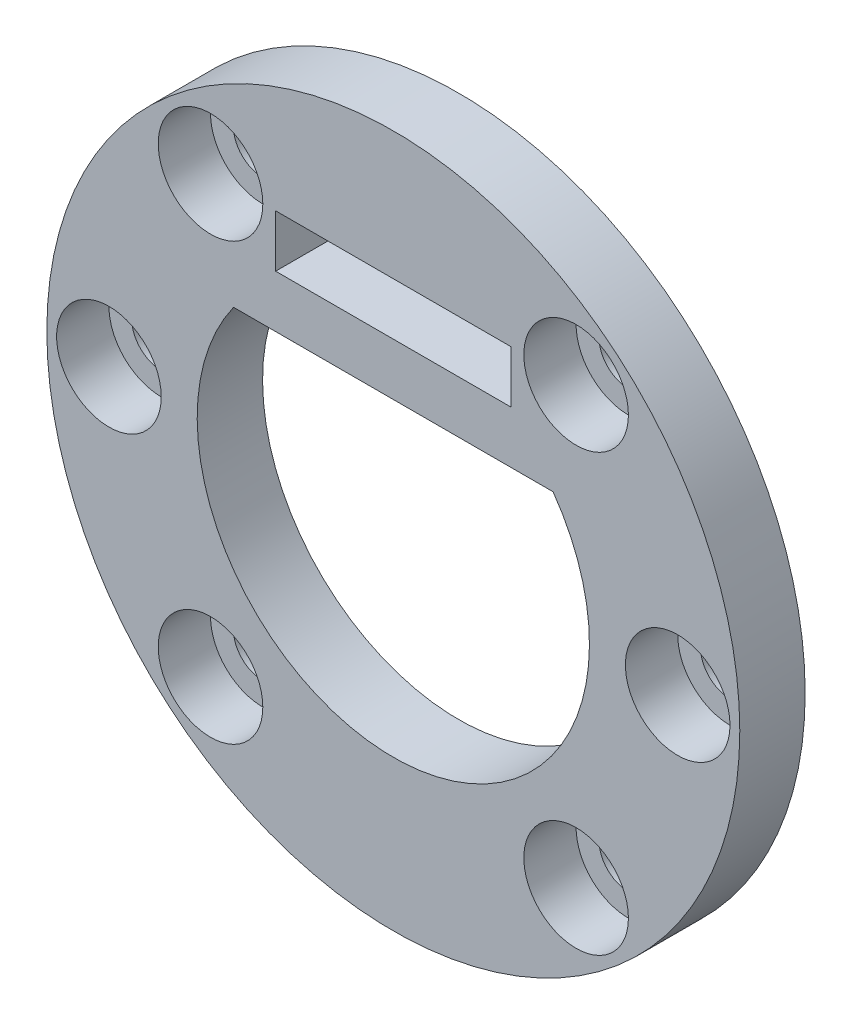
from build123d import *
from build123d.topology import SkipClean

# Parameters (mm, degrees)
SKETCH_1_R                   = 26.5
EXTRUDE_1_DEPTH              = 5
HOLE_WIZARD_M4_1_AT_2_COUNT  = 2
HOLE_WIZARD_M4_1_AT_2_PITCH  = 39.424388736
HOLE_WIZARD_M4_1_AT_3_COUNT  = 2
HOLE_WIZARD_M4_1_AT_3_PITCH  = 39.424388736
HOLE_WIZARD_M4_1_AT_4_COUNT  = 2
HOLE_WIZARD_M4_1_AT_4_PITCH  = 18.383894388
HOLE_WIZARD_M4_1_AT_5_COUNT  = 2
HOLE_WIZARD_M4_1_AT_5_PITCH  = 43.5
HOLE_WIZARD_M4_1_AT_6_COUNT  = 2
HOLE_WIZARD_M4_1_AT_6_PITCH  = 39.424388736
HOLE_WIZARD_M4_1_AT_7_COUNT  = 2
HOLE_WIZARD_M4_1_AT_7_PITCH  = 18.383894388
EXTRUDE_1551_DEPTH           = 8
CUT_EXTRUDE_START            = 22
SKETCH_6_R                   = 4
CUT_EXTRUDE_1661_DEPTH       = 22
SKETCH_8_R                   = 34.5
CUT_EXTRUDE_1747_DEPTH       = 119.962346984
HOLE_WIZARD_M3_1_D           = 3.4
HOLE_WIZARD_M3_1_CBORE_D     = 6.5
HOLE_WIZARD_M3_1_CBORE_DEPTH = 3
CUT_EXTRUDE_1_DEPTH          = 15
CUT_EXTRUDE_2_DEPTH          = 5
CUT_EXTRUDE_3_DEPTH          = 10
SKETCH_15_W                  = 96
SKETCH_15_H                  = 8
CUT_EXTRUDE_4_DEPTH          = 113.29536945
CUT_EXTRUDE_5_DEPTH          = 10


with BuildPart() as part:
    # 草图1 → 凸台-拉伸1 (new body)
    with BuildSketch(Plane.XY):
        Circle(SKETCH_1_R)
    extrude(amount=EXTRUDE_1_DEPTH)

    # 草图3 → M4 六角凹头盖的柱孔1 (revolve, cut)
    with BuildSketch(Plane(origin=(21.75, 0, 5), x_dir=(0, -1, 0), z_dir=(1, 0, 0))):
        Polygon((0, 0), (0, 5), (2.25, 5), (2.25, 4), (4, 4), (4, 0), align=None)
    hole_wizard_m4_1 = revolve(axis=Axis((21.75, 0, 11.35), (0, 0, -1)), mode=Mode.SUBTRACT)

    # M4 六角凹头盖的柱孔1 at 2: M4 六角凹头盖的柱孔1 ×2
    with Locations(*[Vector(-0.9063077870366496, 0.4226182617407002, 0) * (i * HOLE_WIZARD_M4_1_AT_2_PITCH) for i in range(1, HOLE_WIZARD_M4_1_AT_2_COUNT)]):
        add(hole_wizard_m4_1, mode=Mode.SUBTRACT)

    # M4 六角凹头盖的柱孔1 at 3: M4 六角凹头盖的柱孔1 ×2
    with Locations(*[Vector(-0.9063077870125524, 0.42261826179237694, 0) * (i * HOLE_WIZARD_M4_1_AT_3_PITCH) for i in range(1, HOLE_WIZARD_M4_1_AT_3_COUNT)]):
        add(hole_wizard_m4_1, mode=Mode.SUBTRACT)

    # M4 六角凹头盖的柱孔1 at 4: M4 六角凹头盖的柱孔1 ×2
    with Locations(*[Vector(-0.42261826172613215, 0.9063077870434428, 0) * (i * HOLE_WIZARD_M4_1_AT_4_PITCH) for i in range(1, HOLE_WIZARD_M4_1_AT_4_COUNT)]):
        add(hole_wizard_m4_1, mode=Mode.SUBTRACT)

    # M4 六角凹头盖的柱孔1 at 5: M4 六角凹头盖的柱孔1 ×2
    with Locations(*[(-i * HOLE_WIZARD_M4_1_AT_5_PITCH, 0, 0) for i in range(1, HOLE_WIZARD_M4_1_AT_5_COUNT)]):
        add(hole_wizard_m4_1, mode=Mode.SUBTRACT)

    # M4 六角凹头盖的柱孔1 at 6: M4 六角凹头盖的柱孔1 ×2
    with Locations(*[Vector(-0.9063077870125524, -0.42261826179237694, 0) * (i * HOLE_WIZARD_M4_1_AT_6_PITCH) for i in range(1, HOLE_WIZARD_M4_1_AT_6_COUNT)]):
        add(hole_wizard_m4_1, mode=Mode.SUBTRACT)

    # M4 六角凹头盖的柱孔1 at 7: M4 六角凹头盖的柱孔1 ×2
    with Locations(*[Vector(-0.42261826172613215, -0.9063077870434428, 0) * (i * HOLE_WIZARD_M4_1_AT_7_PITCH) for i in range(1, HOLE_WIZARD_M4_1_AT_7_COUNT)]):
        add(hole_wizard_m4_1, mode=Mode.SUBTRACT)

    # 草图5 → Extrude 1551 (add)
    with BuildSketch(Plane.XZ.offset(-8.7)):
        with BuildLine():
            Line((-26.5, 5), (-26.5, 14.978130978))
            ThreePointArc((-26.5, 14.978130978), (0, 103), (26.5, 14.978130978))
            Line((26.5, 14.978130978), (26.5, 5))
            Line((26.5, 5), (-26.5, 5))
        make_face()
    extrude(amount=-EXTRUDE_1551_DEPTH)

    # 草图6 → Cut-Extrude 1661 (cut)
    with SkipClean():  # the faces are left unmerged after this step: merging them gives an invalid solid
        with BuildSketch(Plane.XY.offset(5).offset(CUT_EXTRUDE_START)):
            with Locations((-13.98063051, 16.66146664)):
                Circle(SKETCH_6_R)
            with Locations((13.98063051, 16.66146664)):
                Circle(SKETCH_6_R)
        extrude(amount=-CUT_EXTRUDE_1661_DEPTH, mode=Mode.SUBTRACT)
    add(part.part.scale(1), mode=Mode.REPLACE)  # the faces are merged on a copy

    # 草图8 → Cut-Extrude 1747 (cut, through all)
    with BuildSketch(Plane.XZ.offset(-8.7)):
        with Locations((0, 55)):
            Circle(SKETCH_8_R)
    extrude(amount=-CUT_EXTRUDE_1747_DEPTH, mode=Mode.SUBTRACT)

    # M3 六角凹头盖的柱孔1 (through all)
    with Locations(Plane(origin=(-9.576304669, 16.7, 19.260744427), x_dir=(0, 0, 1), z_dir=(0, 1, 0))):
        with Locations((0, 0), (0, 19.152609338), (9.576304669, 35.739255573), (26.162950904, 45.315560242), (45.315560242, 45.315560242), (62.358629164, 36.19567826), (71.478511143, 19.152609339), (71.478511146, 0), (61.902206477, -16.586646235), (9.576304669, -16.586646235), (26.162950904, -26.162950904), (45.315560242, -26.162950904)):
            CounterBoreHole(HOLE_WIZARD_M3_1_D / 2, HOLE_WIZARD_M3_1_CBORE_D / 2, HOLE_WIZARD_M3_1_CBORE_DEPTH)

    # 草图11 → 切除-拉伸1 (cut)
    with BuildSketch(Plane.XY):
        with BuildLine():
            Line((-25.031180555, 8.7), (-29.031180555, 8.7))
            Line((-29.031180555, 8.7), (-29.031180555, 16.7))
            Line((-29.031180555, 16.7), (-20.575713839, 16.7))
            ThreePointArc((-20.575713839, 16.7), (-23.151613423, 12.893905379), (-25.031180555, 8.7))
        make_face()
        with BuildLine():
            Line((29.031180555, 16.7), (20.575713839, 16.7))
            ThreePointArc((20.575713839, 16.7), (23.151613423, 12.893905379), (25.031180555, 8.7))
            Line((25.031180555, 8.7), (29.031180555, 8.7))
            Line((29.031180555, 8.7), (29.031180555, 16.7))
        make_face()
    extrude(amount=CUT_EXTRUDE_1_DEPTH, mode=Mode.SUBTRACT)

    # 草图12 → 切除-拉伸2 (cut)
    with BuildSketch(Plane.XZ.offset(-8.7)):
        with BuildLine():
            Line((30.640436297, 73.992699353), (39.299497484, 79.033088453))
            ThreePointArc((39.299497484, 79.033088453), (22.961941343, 94.93481054), (1, 101.054748323))
            Line((1, 101.054748323), (1, 90.986108088))
            ThreePointArc((1, 90.986108088), (3.29678588, 90.848726312), (5.580104544, 90.56490417))
            ThreePointArc((5.580104544, 90.56490417), (10.611585442, 94.602959438), (12.949935188, 88.59015553))
            ThreePointArc((12.949935188, 88.59015553), (18.110429302, 86.112886725), (22.813026139, 82.848971404))
            ThreePointArc((22.813026139, 82.848971404), (29.429042421, 84.466469087), (27.899229179, 77.829629354))
            ThreePointArc((27.899229179, 77.829629354), (29.332637394, 75.956033707), (30.640436297, 73.992699353))
        make_face()
        with BuildLine():
            Line((31.628764833, 37.893824648), (40.299497484, 32.887774818))
            ThreePointArc((40.299497484, 32.887774818), (45.9673073, 55.081606369), (40.220731453, 77.255173811))
            Line((40.220731453, 77.255173811), (31.60381627, 72.239317654))
            ThreePointArc((31.60381627, 72.239317654), (32.667369713, 70.12740004), (33.58998558, 67.95021794))
            ThreePointArc((33.58998558, 67.95021794), (39.603491283, 65.610874453), (35.563251124, 60.5798469))
            ThreePointArc((35.563251124, 60.5798469), (35.998326415, 55.004146142), (35.564535509, 49.428345312))
            ThreePointArc((35.564535509, 49.428345312), (39.60579141, 44.366506044), (33.551263667, 42.065058704))
            ThreePointArc((33.551263667, 42.065058704), (32.656681203, 39.948715244), (31.628764833, 37.893824648))
        make_face()
        with BuildLine():
            Line((19.898823765, 25.001394455), (25.409425198, 16.693850218))
            ThreePointArc((25.409425198, 16.693850218), (33.152641178, 23.15816615), (39.299497484, 31.15572401))
            Line((39.299497484, 31.15572401), (30.628764833, 36.161773841))
            ThreePointArc((30.628764833, 36.161773841), (29.36313556, 34.244126853), (27.977619592, 32.411223983))
            ThreePointArc((27.977619592, 32.411223983), (29.011771602, 26.01712548), (22.607462255, 26.98603612))
            ThreePointArc((22.607462255, 26.98603612), (21.276296399, 25.962115548), (19.898823765, 25.001394455))
        make_face()
        with BuildLine():
            Line((-1, 90.986108088), (-1, 101.054748323))
            ThreePointArc((-1, 101.054748323), (-22.961941343, 94.93481054), (-39.299497484, 79.033088453))
            Line((-39.299497484, 79.033088453), (-30.640436297, 73.992699353))
            ThreePointArc((-30.640436297, 73.992699353), (-29.332637394, 75.956033707), (-27.899229179, 77.829629354))
            ThreePointArc((-27.899229179, 77.829629354), (-29.429042421, 84.466469087), (-22.813026139, 82.848971404))
            ThreePointArc((-22.813026139, 82.848971404), (-18.110429302, 86.112886725), (-12.949935188, 88.59015553))
            ThreePointArc((-12.949935188, 88.59015553), (-10.611585442, 94.602959438), (-5.580104544, 90.56490417))
            ThreePointArc((-5.580104544, 90.56490417), (-3.29678588, 90.848726312), (-1, 90.986108088))
        make_face()
        with BuildLine():
            ThreePointArc((-33.58998558, 67.95021794), (-32.667369713, 70.12740004), (-31.60381627, 72.239317654))
            Line((-31.60381627, 72.239317654), (-40.220731453, 77.255173811))
            ThreePointArc((-40.220731453, 77.255173811), (-45.9673073, 55.081606369), (-40.299497484, 32.887774818))
            Line((-40.299497484, 32.887774818), (-31.628764833, 37.893824648))
            ThreePointArc((-31.628764833, 37.893824648), (-32.656681203, 39.948715244), (-33.551263667, 42.065058704))
            ThreePointArc((-33.551263667, 42.065058704), (-39.60579141, 44.366506044), (-35.564535509, 49.428345312))
            ThreePointArc((-35.564535509, 49.428345312), (-35.998326415, 55.004146142), (-35.563251124, 60.5798469))
            ThreePointArc((-35.563251124, 60.5798469), (-39.603491283, 65.610874453), (-33.58998558, 67.95021794))
        make_face()
        with BuildLine():
            Line((-30.628764833, 36.161773841), (-39.299497484, 31.15572401))
            ThreePointArc((-39.299497484, 31.15572401), (-33.152641178, 23.15816615), (-25.409425198, 16.693850218))
            Line((-25.409425198, 16.693850218), (-19.898823765, 25.001394455))
            ThreePointArc((-19.898823765, 25.001394455), (-21.276296399, 25.962115548), (-22.607462255, 26.98603612))
            ThreePointArc((-22.607462255, 26.98603612), (-29.011771602, 26.01712548), (-27.977619592, 32.411223983))
            ThreePointArc((-27.977619592, 32.411223983), (-29.36313556, 34.244126853), (-30.628764833, 36.161773841))
        make_face()
    extrude(amount=-CUT_EXTRUDE_2_DEPTH, mode=Mode.SUBTRACT)

    # 草图13 → 切除-拉伸3 (cut)
    with BuildSketch(Plane.XY.offset(5)):
        with BuildLine():
            Line((-12.219247113, 8.7), (12.219247113, 8.7))
            ThreePointArc((12.219247113, 8.7), (0, -15), (-12.219247113, 8.7))
        make_face()
    extrude(amount=-CUT_EXTRUDE_3_DEPTH, mode=Mode.SUBTRACT)

    # 草图15 → 切除-拉伸4 (cut, through all)
    with BuildSketch(Plane.XY.offset(5)):
        with Locations((0, 12.7)):
            Rectangle(SKETCH_15_W, SKETCH_15_H)
    extrude(amount=CUT_EXTRUDE_4_DEPTH, mode=Mode.SUBTRACT)

    # 草图17 → 切除-拉伸5 (cut)
    with BuildSketch(Plane.XY.offset(5)):
        Polygon((0, 12.7), (-9, 12.7), (-9, 16.7), (9, 16.7), (9, 12.7), align=None)
    extrude(amount=-CUT_EXTRUDE_5_DEPTH, mode=Mode.SUBTRACT)


solid = part.part
